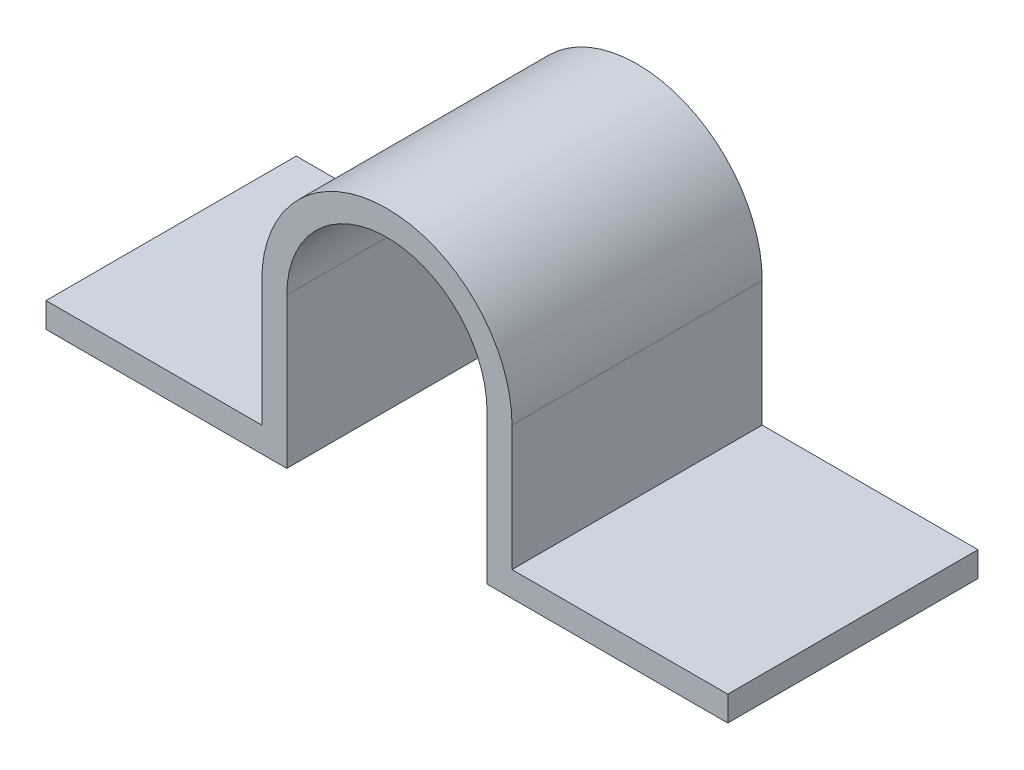
from build123d import *

# Parameters (mm, degrees)
EXTRUDE_1_DEPTH = 10


with BuildPart() as part:
    # 草图1 → 凸台-拉伸1 (new body)
    with BuildSketch(Plane.XY):
        with BuildLine():
            Line((5, 6), (5, 1))
            Line((5, 1), (13.623322376, 1))
            Line((13.623322376, 1), (13.623322376, 0))
            Line((13.623322376, 0), (4, 0))
            Line((4, 0), (4, 6))
            ThreePointArc((4, 6), (0, 10), (-4, 6))
            Line((-4, 6), (-4, 0))
            Line((-4, 0), (-13.623322376, 0))
            Line((-13.623322376, 0), (-13.623322376, 1))
            Line((-13.623322376, 1), (-5, 1))
            Line((-5, 1), (-5, 6))
            ThreePointArc((-5, 6), (0, 11), (5, 6))
        make_face()
    extrude(amount=EXTRUDE_1_DEPTH)


solid = part.part
